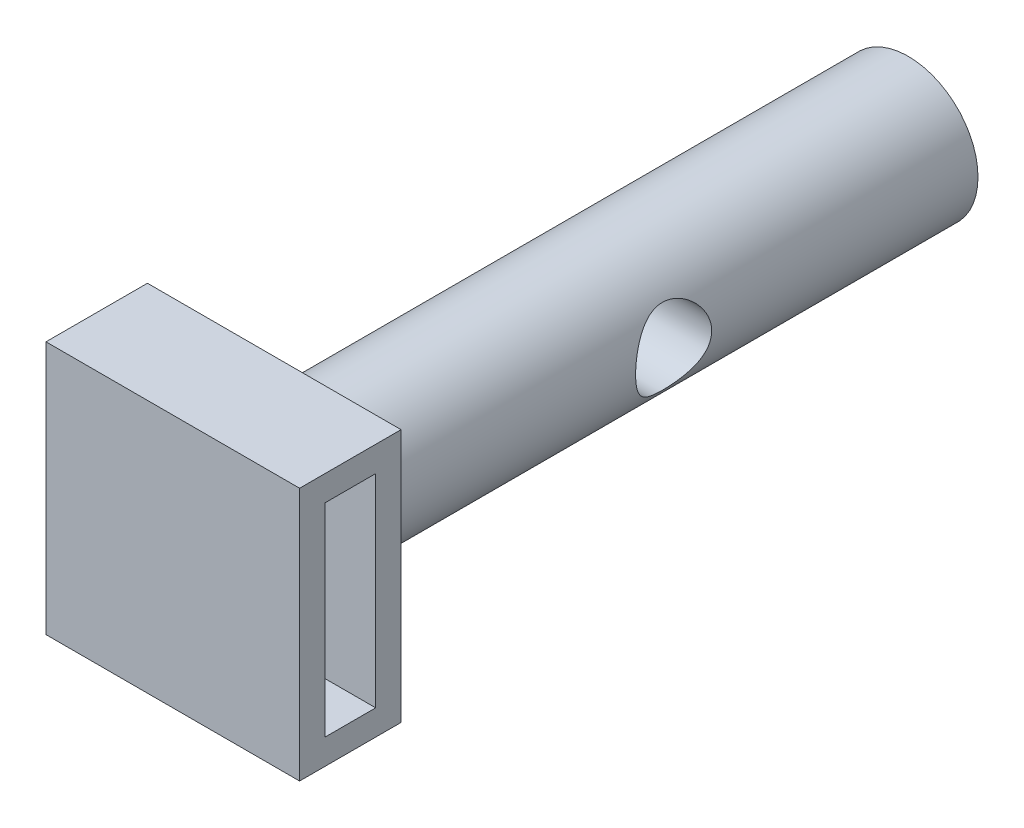
from build123d import *

# Parameters (mm, degrees)
SKETCH2_R               = 2.75
SKETCH3_R               = 2.75
SKETCH3_7_W             = 10
SKETCH3_7_H             = 10
BOSS_EXTRUDE4_DEPTH     = 4
CUT_EXTRUDE2_DEPTH      = 32.080540536
CUT_EXTRUDE2_DEPTH_BACK = 32.080540536
SKETCH8_W               = 2
SKETCH8_H               = 8
FILLET1_R               = 1
CUT_EXTRUDE4_DEPTH      = 30.849623113
CUT_EXTRUDE4_DEPTH_BACK = 30.849623113
SKETCH11_R              = 1.5


with BuildPart() as part:
    # Sketch2 → Loft1 section 0
    with BuildSketch(Plane.XY):
        Circle(SKETCH2_R)
    # Sketch3 → Loft1 section 1
    with BuildSketch(Plane.XY.offset(25)):
        Circle(SKETCH3_R)
    loft()

    # Sketch3<7> → Boss-Extrude4 (add)
    with BuildSketch(Plane.XY.offset(25)):
        Rectangle(SKETCH3_7_W, SKETCH3_7_H)
    extrude(amount=BOSS_EXTRUDE4_DEPTH)

    # Sketch8 → Cut-Extrude2 (cut, two sides: drawn at the far end of the back side and taken through both)
    with BuildSketch(Plane(origin=(5, 0, 0), x_dir=(0, 0, -1), z_dir=(1, 0, 0)).offset(-CUT_EXTRUDE2_DEPTH_BACK)):
        with Locations((-27, 0)):
            Rectangle(SKETCH8_W, SKETCH8_H)
    extrude(amount=CUT_EXTRUDE2_DEPTH + CUT_EXTRUDE2_DEPTH_BACK, mode=Mode.SUBTRACT)

    # Fillet1
    fillet1_edges = [part.edges().sort_by_distance(p)[0] for p in [
        (-2.75, 0, 25),
    ]]
    fillet(fillet1_edges, radius=FILLET1_R)

    # Sketch11 → Cut-Extrude4 (cut, two sides: drawn at the far end of the back side and taken through both)
    with BuildSketch(Plane(origin=(0, 0, 0), x_dir=(0, 0, -1), z_dir=(1, 0, 0)).offset(-CUT_EXTRUDE4_DEPTH_BACK)):
        with Locations((-12, 0)):
            Circle(SKETCH11_R)
    extrude(amount=CUT_EXTRUDE4_DEPTH + CUT_EXTRUDE4_DEPTH_BACK, mode=Mode.SUBTRACT)


solid = part.part
